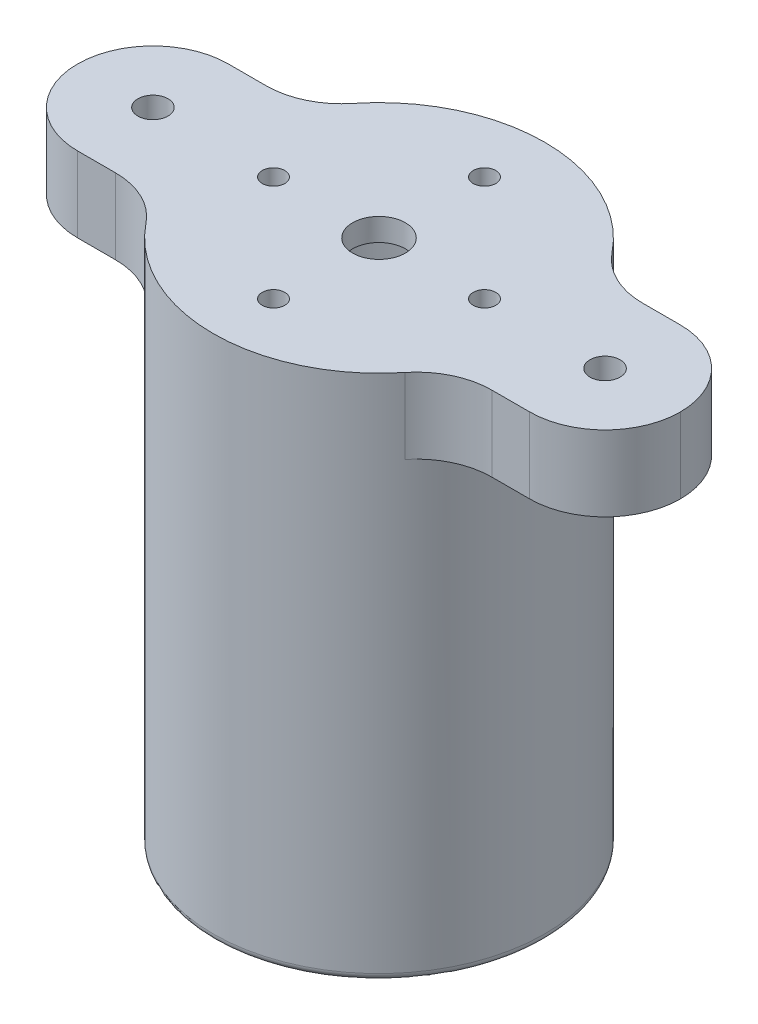
from build123d import *

# Parameters (mm, degrees)
SKETCH3_R           = 22
BOSS_EXTRUDE1_DEPTH = 70
SKETCH14_W          = 80
SKETCH14_H          = 20
BOSS_EXTRUDE3_DEPTH = 10
SKETCH4_R           = 19
CUT_EXTRUDE1_DEPTH  = 65
SKETCH5_R           = 3.5
CUT_EXTRUDE2_DEPTH  = 5
SKETCH7_R           = 1.5
CUT_EXTRUDE3_DEPTH  = 5
SKETCH15_R          = 2
CUT_EXTRUDE6_DEPTH  = 10
FILLET1_R           = 10
FILLET2_R           = 10
FILLET3_R           = 10
FILLET4_R           = 1
SKETCH16_R          = 11
CUT_EXTRUDE7_DEPTH  = 2


with BuildPart() as part:
    # Sketch3 → Boss-Extrude1 (new body)
    with BuildSketch(Plane(origin=(0, 0, 0), x_dir=(1, 0, 0), z_dir=(0, 1, 0))):
        with Locations(Location((0, 0, 0), (0, 0, 270))):
            Circle(SKETCH3_R)
    extrude(amount=BOSS_EXTRUDE1_DEPTH)

    # Sketch14 → Boss-Extrude3 (add)
    with BuildSketch(Plane(origin=(0, 70, 0), x_dir=(1, 0, 0), z_dir=(0, 1, 0))):
        Rectangle(SKETCH14_W, SKETCH14_H)
    extrude(amount=-BOSS_EXTRUDE3_DEPTH)

    # Sketch4 → Cut-Extrude1 (cut)
    with BuildSketch(Plane(origin=(0, 0, 0), x_dir=(-1, 0, 0), z_dir=(0, -1, 0))):
        with Locations(Location((0, 0, 0), (0, 0, 90))):
            Circle(SKETCH4_R)
    extrude(amount=-CUT_EXTRUDE1_DEPTH, mode=Mode.SUBTRACT)

    # Sketch5 → Cut-Extrude2 (cut)
    with BuildSketch(Plane(origin=(0, 70, 0), x_dir=(1, 0, 0), z_dir=(0, 1, 0))):
        with Locations(Location((0, 0, 0), (0, 0, 270))):
            Circle(SKETCH5_R)
    extrude(amount=-CUT_EXTRUDE2_DEPTH, mode=Mode.SUBTRACT)

    # Sketch7 → Cut-Extrude3 (cut)
    with BuildSketch(Plane(origin=(0, 70, 0), x_dir=(1, 0, 0), z_dir=(0, 1, 0))):
        with Locations(Location((0, -14, 0), (0, 0, 270))):
            Circle(SKETCH7_R)
        with Locations(Location((0, 14, 0), (0, 0, 270))):
            Circle(SKETCH7_R)
        with Locations(Location((14, 0, 0), (0, 0, 270))):
            Circle(SKETCH7_R)
        with Locations(Location((-14, 0, 0), (0, 0, 270))):
            Circle(SKETCH7_R)
    extrude(amount=-CUT_EXTRUDE3_DEPTH, mode=Mode.SUBTRACT)

    # Sketch15 → Cut-Extrude6 (cut)
    with BuildSketch(Plane(origin=(0, 70, 0), x_dir=(1, 0, 0), z_dir=(0, 1, 0))):
        with Locations(Location((30, 0, 0), (0, 0, 270))):
            Circle(SKETCH15_R)
        with Locations(Location((-30, 0, 0), (0, 0, 270))):
            Circle(SKETCH15_R)
    extrude(amount=-CUT_EXTRUDE6_DEPTH, mode=Mode.SUBTRACT)

    # Fillet1
    fillet1_edges = [part.edges().sort_by_distance(p)[0] for p in [
        (40, 65, -10),
        (40, 65, 10),
    ]]
    fillet(fillet1_edges, radius=FILLET1_R - 0.0001)  # a hair under: the kernel refuses the full size

    # Fillet2
    fillet2_edges = [part.edges().sort_by_distance(p)[0] for p in [
        (-40, 65, -10),
        (-40, 65, 10),
    ]]
    fillet(fillet2_edges, radius=FILLET2_R - 0.0001)  # a hair under: the kernel refuses the full size

    # Fillet3
    fillet3_edges = [part.edges().sort_by_distance(p)[0] for p in [
        (-19.595917942, 65, 10),
        (19.595917942, 65, 10),
        (19.595917942, 65, -10),
        (-19.595917942, 65, -10),
    ]]
    fillet(fillet3_edges, radius=FILLET3_R)

    # Fillet4
    fillet4_edges = [part.edges().sort_by_distance(p)[0] for p in [
        (0, 0, -22),
        (0, 0, 19),
    ]]
    fillet(fillet4_edges, radius=FILLET4_R)

    # Sketch16 → Cut-Extrude7 (cut)
    with BuildSketch(Plane.XZ.offset(-65)):
        with Locations(Location((0, 0, 0), (0, 0, 270))):
            Circle(SKETCH16_R)
    extrude(amount=-CUT_EXTRUDE7_DEPTH, mode=Mode.SUBTRACT)


solid = part.part
